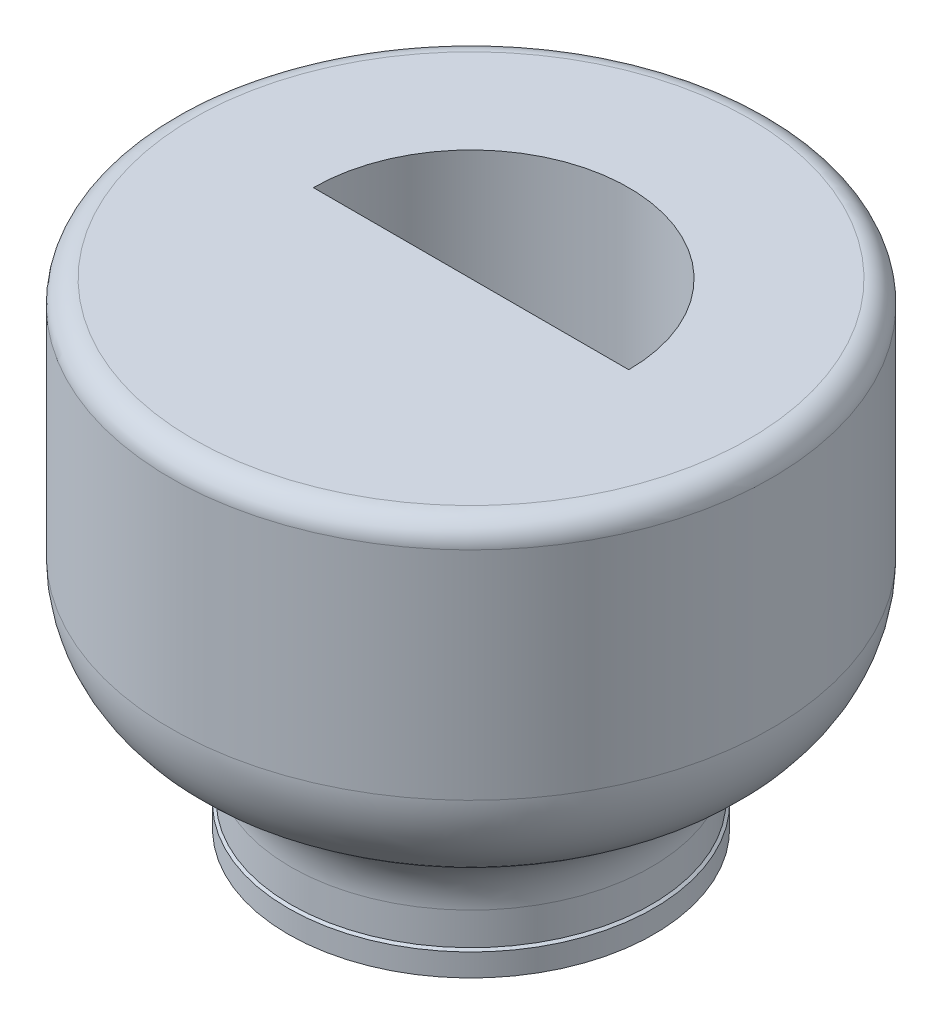
from build123d import *

# Parameters (mm, degrees)
CUT_EXTRUDE3_DEPTH      = 60
CUT_EXTRUDE5_DEPTH      = 2
CUT_EXTRUDE5_DEPTH_BACK = 35


with BuildPart() as part:
    # Sketch1 → Revolve1 (revolve)
    with BuildSketch(Plane.XY):
        with BuildLine():
            Line((0, 63.427876097), (37, 63.427876097))
            ThreePointArc((37, 63.427876097), (39.121320344, 62.54919644), (40, 60.427876097))
            Line((40, 60.427876097), (40, 31.556288966))
            ThreePointArc((40, 31.556288966), (38.188122658, 24.409721904), (33.190210564, 18.989648567))
            Line((33.190210564, 18.989648567), (28.539859624, 15.958818353))
            ThreePointArc((28.539859624, 15.958818353), (25.207918228, 12.345436129), (24, 7.581058088))
            Line((24, 7.581058088), (24, 3.25))
            Line((24, 3.25), (24.35, 3))
            Line((24.35, 3), (24.35, 0))
            Line((24.35, 0), (22.5, 0))
            Line((22.5, 0), (22.5, 12.5))
            ThreePointArc((22.5, 12.5), (22.353553391, 12.853553391), (22, 13))
            Line((22, 13), (0, 13))
            Line((0, 13), (0, 63.427876097))
        make_face()
    revolve(axis=Axis((0, 0, 0), (0, 1, 0)))

    # Sketch11 → Cut-Extrude3 (cut)
    with BuildSketch(Plane(origin=(0, 13, 0), x_dir=(-1, 0, 0), z_dir=(0, -1, 0))):
        with BuildLine():
            Line((-21, 0), (21, 0))
            ThreePointArc((21, 0), (0, 21), (-21, 0))
        make_face()
    extrude(amount=-CUT_EXTRUDE3_DEPTH, mode=Mode.SUBTRACT)

    # Sketch9 → Cut-Extrude5 (cut, two sides: drawn at the far end of the back side and taken through both)
    with BuildSketch(Plane(origin=(0, 60.427876097, 0), x_dir=(1, 0, 0), z_dir=(0, 1, 0)).offset(-CUT_EXTRUDE5_DEPTH_BACK)):
        with BuildLine():
            Line((-37, -1.601545046), (37, -2.398454954))
            ThreePointArc((37, -2.398454954), (-0.376939953, -37.002145429), (-37, -1.601545046))
        make_face()
    extrude(amount=CUT_EXTRUDE5_DEPTH + CUT_EXTRUDE5_DEPTH_BACK, mode=Mode.SUBTRACT)


solid = part.part
